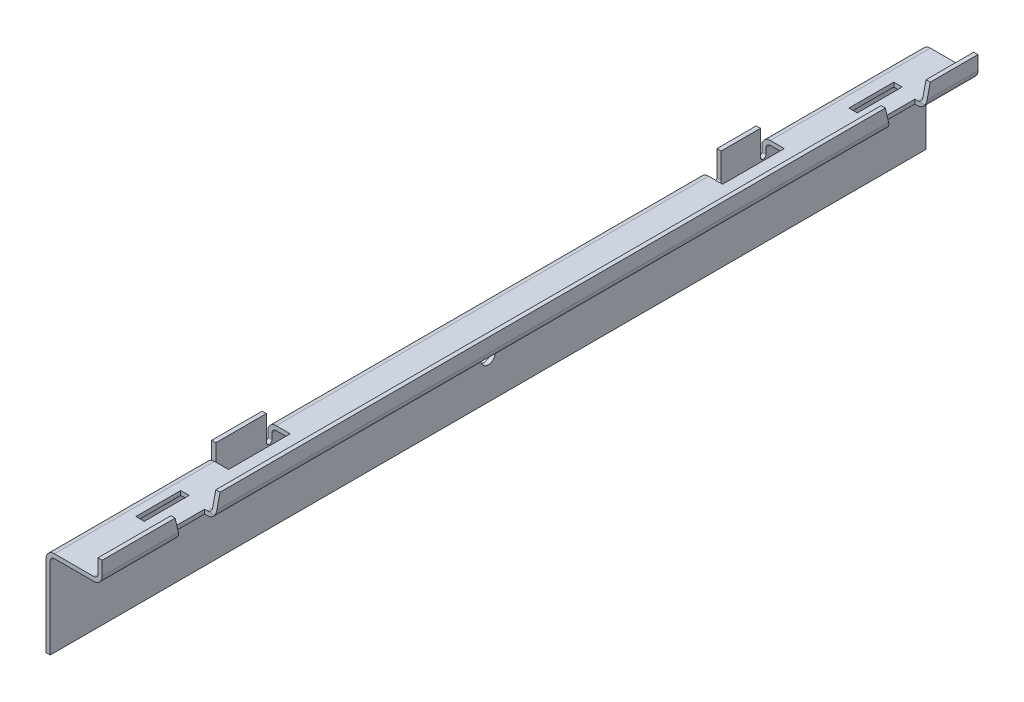
from build123d import *

# Parameters (mm, degrees)
EXTRUDE1_DEPTH     = 247.65
SKETCH2_W          = 34.925
SKETCH2_H          = 9.525
CUT_EXTRUDE1_DEPTH = 12.7
SKETCH3_W          = 2.38125
SKETCH3_H          = 22.225
SKETCH3_H_2        = 28.575
EXTRUDE2_DEPTH     = 15.875
FILLET1_R          = 1.5875
SKETCH4_W          = 4.7625
SKETCH4_H          = 25.4
CUT_EXTRUDE2_DEPTH = 2.38125
CUT_EXTRUDE3_DEPTH = 6.35
SKETCH6_R          = 3.96875
CUT_EXTRUDE4_DEPTH = 2.38125


with BuildPart() as part:
    # Sketch1 → Extrude1 (new, symmetric)
    with BuildSketch(Plane.XY):
        with BuildLine():
            Line((0, 46.0375), (0, 0))
            Line((0, 0), (2.38125, 0))
            Line((2.38125, 0), (2.38125, 46.0375))
            ThreePointArc((2.38125, 46.0375), (3.078701977, 47.721298023), (4.7625, 48.41875))
            Line((4.7625, 48.41875), (26.9875, 48.41875))
            ThreePointArc((26.9875, 48.41875), (30.355096045, 49.813653955), (31.75, 53.18125))
            Line((31.75, 53.18125), (31.75, 61.11875))
            Line((31.75, 61.11875), (29.36875, 61.11875))
            Line((29.36875, 61.11875), (29.36875, 53.18125))
            ThreePointArc((29.36875, 53.18125), (28.671298023, 51.497451977), (26.9875, 50.8))
            Line((26.9875, 50.8), (4.7625, 50.8))
            ThreePointArc((4.7625, 50.8), (1.394903955, 49.405096045), (0, 46.0375))
        make_face()
    extrude(amount=EXTRUDE1_DEPTH, both=True)

    # Sketch2 → Cut-Extrude1 (cut)
    with BuildSketch(Plane.ZY):
        with Locations((-139.7, 46.0375)):
            Rectangle(SKETCH2_W, SKETCH2_H)
        with Locations((139.7, 46.0375)):
            Rectangle(SKETCH2_W, SKETCH2_H)
    extrude(amount=-CUT_EXTRUDE1_DEPTH, mode=Mode.SUBTRACT)

    # Sketch3 → Extrude2 (add)
    with BuildSketch(Plane(origin=(0, 41.275, 0), x_dir=(1, 0, 0), z_dir=(0, 1, 0))):
        with Locations((1.190625, 142.875)):
            Rectangle(SKETCH3_W, SKETCH3_H)
        with Locations((1.190625, -139.7)):
            Rectangle(SKETCH3_W, SKETCH3_H_2)
    extrude(amount=EXTRUDE2_DEPTH)

    # Fillet1
    fillet1_edges = [part.edges().sort_by_distance(p)[0] for p in [
        (1.190625, 41.275, 125.4125),
        (1.190625, 41.275, 153.9875),
        (1.190625, 41.275, -157.1625),
        (1.190625, 41.275, 157.1625),
        (1.190625, 41.275, 122.2375),
        (1.190625, 41.275, -153.9875),
        (1.190625, 41.275, -131.7625),
    ]]
    fillet(fillet1_edges, radius=FILLET1_R - 0.0001)  # a hair under: the kernel refuses the full size

    # Sketch4 → Cut-Extrude2 (cut)
    with BuildSketch(Plane(origin=(0, 50.8, 0), x_dir=(1, 0, 0), z_dir=(0, 1, 0))):
        with Locations((13.49375, 207.9625)):
            Rectangle(SKETCH4_W, SKETCH4_H)
        with Locations((11.90625, -193.675)):
            Rectangle(SKETCH4_W, SKETCH4_H)
    extrude(amount=-CUT_EXTRUDE2_DEPTH, mode=Mode.SUBTRACT)

    # Sketch5 → Cut-Extrude3 (cut)
    with BuildSketch(Plane(origin=(31.75, 0, 0), x_dir=(0, 0, -1), z_dir=(1, 0, 0))):
        Polygon((195.2625, 61.11875), (220.6625, 61.11875), (218.28125, 50.8), (218.28125, 48.41875), (197.64375, 48.41875), (197.64375, 50.8), align=None)
        Polygon((-180.975, 61.11875), (-206.375, 61.11875), (-203.99375, 50.8), (-203.99375, 48.41875), (-183.35625, 48.41875), (-183.35625, 50.8), align=None)
    extrude(amount=-CUT_EXTRUDE3_DEPTH, mode=Mode.SUBTRACT)

    # Sketch6 → Cut-Extrude4 (cut)
    with BuildSketch(Plane.ZY):
        with Locations((0, 22.225)):
            Circle(SKETCH6_R)
    extrude(amount=-CUT_EXTRUDE4_DEPTH, mode=Mode.SUBTRACT)


solid = part.part
